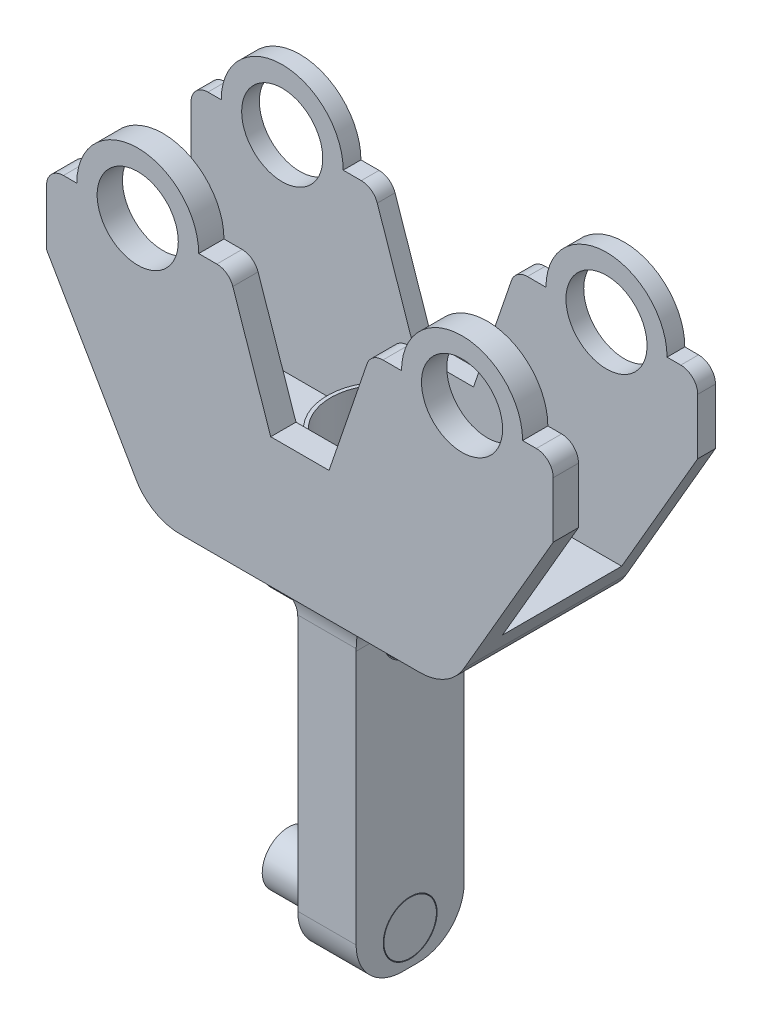
from build123d import *

# Parameters (mm, degrees)
BOSS_EXTRU_1_DEPTH           = 1.2
BOSS_EXTRU_1_DEPTH_BACK      = 1.2
BOSS_EXTRU_3_DEPTH           = 0.8
BOSS_EXTRU_3_DEPTH_BACK      = 0.8
CONG_1_R                     = 0.6
ENL_V_MAT_EXTRU_1_DEPTH      = 0.8
ENL_V_MAT_EXTRU_1_DEPTH_BACK = 1.2
ESQUISSE3_R                  = 0.39855318391120886
ESQUISSE3_R_2                = 0.3998963443973292
ESQUISSE4_R                  = 0.388799523274085
BOSS_EXTRU_4_DEPTH           = 1.8
ESQUISSE4_R_2                = 0.3866675679352152
BOSS_EXTRU_4_2_DEPTH         = 1.8
ENL_V_MAT_EXTRU_2_DEPTH      = 2.8
ENL_V_MAT_EXTRU_2_DEPTH_BACK = 1.2
ESQUISSE5_W                  = 8.040608678581814
ESQUISSE5_H                  = 1.7635077316521461
ESQUISSE6_R                  = 0.5999999999999998
ENL_V_MAT_EXTRU_3_DEPTH      = 2.8
ESQUISSE7_R                  = 0.850642706215731
ESQUISSE7_R_2                = 0.7992203183173335
BOSS_EXTRU_5_DEPTH           = 0.89
ESQUISSE8_R                  = 0.5002156559531135
ENL_V_MAT_EXTRU_4_DEPTH      = 0.8
CONG_2_R                     = 0.75
CONG_3_R                     = 0.25
CONG_4_R                     = 0.685


with BuildPart() as part:
    # Esquisse1 → Boss.-Extru.1 (new, two sides: drawn at the far end of the back side and taken through both)
    with BuildSketch(Plane.XY.offset(-BOSS_EXTRU_1_DEPTH_BACK)):
        with BuildLine():
            Line((-0.669489396089797, 0.2561851906117251), (-2.2103508294642955, 2.912288317285255))
            Line((-2.2103508294642955, 2.912288317285255), (-2.2103508294642955, 3.987809597780656))
            Line((-2.2103508294642955, 3.987809597780656), (-1.7634137063925426, 3.987809597780656))
            ThreePointArc((-1.7634137063925426, 3.987809597780656), (-0.861394361103266, 4.889828943069933), (0.04062498418601097, 3.987809597780656))
            Line((0.04062498418601097, 3.987809597780656), (0.48756210725776383, 3.987809597780656))
            Line((0.48756210725776383, 3.987809597780656), (1.1061040002270477, 2.173647118407281))
            Line((1.1061040002270477, 2.173647118407281), (1.9690865158121553, 2.173647118407281))
            Line((1.9690865158121553, 2.173647118407281), (2.587628408781439, 3.987809597780656))
            Line((2.587628408781439, 3.987809597780656), (3.04100557345784, 3.987809597780656))
            ThreePointArc((3.04100557345784, 3.987809597780656), (3.9365848771424687, 4.883388901465285), (4.832164180827098, 3.987809597780656))
            Line((4.832164180827098, 3.987809597780656), (5.285541345503499, 3.987809597780656))
            Line((5.285541345503499, 3.987809597780656), (5.285541345503499, 2.912288317285255))
            Line((5.285541345503499, 2.912288317285255), (3.744679912129, 0.2561851906117251))
            Line((3.744679912129, 0.2561851906117251), (-0.669489396089797, 0.2561851906117251))
        make_face()
    extrude(amount=BOSS_EXTRU_1_DEPTH + BOSS_EXTRU_1_DEPTH_BACK)

    # Esquisse1<4> → Boss.-Extru.3 (add, two sides: drawn at the far end of the back side and taken through both)
    with BuildSketch(Plane.XY.offset(-BOSS_EXTRU_3_DEPTH_BACK)):
        Polygon((1.9690865158121553, 0.2561851906117251), (1.1061040002270477, 0.2561851906117251), (1.1061040002270477, 0), (1.1061040002270477, -4.485240552308376), (1.1061040002270477, -4.791310446559649), (1.9690865158121553, -4.791310446559649), (1.969086515812155, -3.887850080955423), (1.9690865158121553, -0.6623689479604176), (1.9690865158121544, 0.05202764865298772), align=None)
    extrude(amount=BOSS_EXTRU_3_DEPTH + BOSS_EXTRU_3_DEPTH_BACK)

    # Congé1
    # the kernel refuses this fillet: 0.6 mm, written as the material it adds along each edge
    with BuildSketch(Plane(origin=(1.1061040002270477, 0.2561851906117251, -0.8), x_dir=(-1, 0, 0), z_dir=(0, 0, 1))) as cong_1_piece_1:
        with BuildLine():
            CenterArc((CONG_1_R, CONG_1_R), CONG_1_R, 180, 90)
            Line((-2.2e-16, CONG_1_R), (-CONG_1_R * 0.02, CONG_1_R))
            Line((-CONG_1_R * 0.02, CONG_1_R), (-CONG_1_R * 0.02, -CONG_1_R * 0.02))
            Line((-CONG_1_R * 0.02, -CONG_1_R * 0.02), (CONG_1_R, -CONG_1_R * 0.02))
            Line((CONG_1_R, -CONG_1_R * 0.02), (CONG_1_R, 0))
        make_face()
    extrude(amount=1.6)
    with BuildSketch(Plane(origin=(1.9690865158121553, 0.2561851906117251, 0.8), x_dir=(0, 1.4e-16, 1), z_dir=(-1, 0, 0))) as cong_1_piece_2:
        with BuildLine():
            CenterArc((0.5999999999999998, -0.5656854249492381), CONG_1_R, 109.47122063449068, 70.52877936550932)
            Line((-1.9e-16, -0.565685424949238), (-0.0120000000000002, -0.565685424949238))
            Line((-0.0120000000000002, -0.565685424949238), (-0.01200000000000001, 0))
            Line((-0.01200000000000001, 0), (0, 0.01200000000000001))
            ThreePointArc((0, 0.01200000000000001), (0.19999999999999996, 0.01199999999999998), (0.3959999999999999, 0.01131370849898478))
            Line((0.3959999999999999, 0.01131370849898478), (0.3999999999999999, 0))
        make_face()
    extrude(amount=0.8629825155851076)
    with BuildSketch(Plane(origin=(1.9690865158121553, 0.2561851906117251, 0.8), x_dir=(1, 0, 0), z_dir=(0, 0, -1))) as cong_1_piece_3:
        with BuildLine():
            CenterArc((CONG_1_R, CONG_1_R), CONG_1_R, 180, 90)
            Line((-2.2e-16, CONG_1_R), (-CONG_1_R * 0.02, CONG_1_R))
            Line((-CONG_1_R * 0.02, CONG_1_R), (-CONG_1_R * 0.02, -CONG_1_R * 0.02))
            Line((-CONG_1_R * 0.02, -CONG_1_R * 0.02), (CONG_1_R, -CONG_1_R * 0.02))
            Line((CONG_1_R, -CONG_1_R * 0.02), (CONG_1_R, 0))
        make_face()
    extrude(amount=1.6)
    with BuildSketch(Plane(origin=(1.9690865158121553, 0.2561851906117251, -0.8), x_dir=(0, 1.4e-16, -1), z_dir=(-1, 0, 0))) as cong_1_piece_4:
        with BuildLine():
            CenterArc((0.5999999999999998, 0.5656854249492381), CONG_1_R, 180, 70.52877936550931)
            Line((-1.9e-16, 0.565685424949238), (-0.0120000000000002, 0.565685424949238))
            Line((-0.0120000000000002, 0.565685424949238), (-0.01200000000000001, 0))
            Line((-0.01200000000000001, 0), (0, -0.01200000000000001))
            ThreePointArc((0, -0.01200000000000001), (0.19999999999999996, -0.01199999999999998), (0.3959999999999999, -0.01131370849898478))
            Line((0.3959999999999999, -0.01131370849898478), (0.3999999999999999, 0))
        make_face()
    extrude(amount=0.8629825155851076)
    with BuildSketch(Plane(origin=(1.1061040002270475, 0.2561851906117251, -2.3), x_dir=(-1, 0, 0), z_dir=(0, 0, 1))) as cong_1_piece_5a_section:
        with BuildLine():
            CenterArc((CONG_1_R, CONG_1_R), CONG_1_R, 180, 90)
            Line((-4.4e-16, CONG_1_R), (-CONG_1_R * 0.02, CONG_1_R))
            Line((-CONG_1_R * 0.02, CONG_1_R), (-CONG_1_R * 0.02, -CONG_1_R * 0.02))
            Line((-CONG_1_R * 0.02, -CONG_1_R * 0.02), (CONG_1_R, -CONG_1_R * 0.02))
            Line((CONG_1_R, -CONG_1_R * 0.02), (CONG_1_R, 0))
        make_face()
    cong_1_piece_5a = extrude(amount=3.0999999999999996, mode=Mode.PRIVATE)
    cong_1_piece_5a = split(cong_1_piece_5a, bisect_by=Plane(origin=(0.9702669316669525, 0.12034812205163004, -1.2), z_dir=(0, 0, 1)), keep=Keep.TOP, mode=Mode.PRIVATE)
    cong_1_piece_5a = split(cong_1_piece_5a, bisect_by=Plane(origin=(0.9702669316669525, 0.12034812205163004, -0.8), z_dir=(0, 0, -1)), keep=Keep.TOP, mode=Mode.PRIVATE)
    with BuildSketch(Plane(origin=(1.9690865158121553, 0.2561851906117251, -0.8), x_dir=(0, 1.4e-16, -1), z_dir=(-1, 0, 0))) as cong_1_piece_5b_section:
        with BuildLine():
            CenterArc((0.5999999999999998, 0.5656854249492381), CONG_1_R, 180, 70.52877936550931)
            Line((-1.9e-16, 0.565685424949238), (-0.0120000000000002, 0.565685424949238))
            Line((-0.0120000000000002, 0.565685424949238), (-0.01200000000000001, 0))
            Line((-0.01200000000000001, 0), (0, -0.01200000000000001))
            ThreePointArc((0, -0.01200000000000001), (0.19999999999999996, -0.01199999999999998), (0.3959999999999999, -0.01131370849898478))
            Line((0.3959999999999999, -0.01131370849898478), (0.3999999999999999, 0))
        make_face()
    cong_1_piece_5b = extrude(amount=2.2771960779582026, mode=Mode.PRIVATE)
    cong_1_piece_5b = split(cong_1_piece_5b, bisect_by=Plane(origin=(1.1061040002270477, 0.12052150444088067, -0.9027063580397728), z_dir=(-1, 0, 0)), keep=Keep.TOP, mode=Mode.PRIVATE)
    cong_1_piece_5 = cong_1_piece_5a & cong_1_piece_5b
    add(cong_1_piece_5)
    with BuildSketch(Plane(origin=(1.9690865158121553, 0.2561851906117251, 0.8), x_dir=(0, 1.4e-16, 1), z_dir=(-1, 0, 0))) as cong_1_piece_6a_section:
        with BuildLine():
            CenterArc((0.5999999999999998, -0.5656854249492381), CONG_1_R, 109.47122063449068, 70.52877936550932)
            Line((-1.9e-16, -0.565685424949238), (-0.0120000000000002, -0.565685424949238))
            Line((-0.0120000000000002, -0.565685424949238), (-0.01200000000000001, 0))
            Line((-0.01200000000000001, 0), (0, 0.01200000000000001))
            ThreePointArc((0, 0.01200000000000001), (0.19999999999999996, 0.01199999999999998), (0.3959999999999999, 0.01131370849898478))
            Line((0.3959999999999999, 0.01131370849898478), (0.3999999999999999, 0))
        make_face()
    cong_1_piece_6a = extrude(amount=2.2771960779582026, mode=Mode.PRIVATE)
    cong_1_piece_6a = split(cong_1_piece_6a, bisect_by=Plane(origin=(1.1061040002270477, 0.12052150444088058, 0.9027063580397728), z_dir=(-1, 0, 0)), keep=Keep.TOP, mode=Mode.PRIVATE)
    with BuildSketch(Plane(origin=(1.1061040002270477, 0.2561851906117251, -0.8), x_dir=(-1, 0, 0), z_dir=(0, 0, 1))) as cong_1_piece_6b_section:
        with BuildLine():
            CenterArc((CONG_1_R, CONG_1_R), CONG_1_R, 180, 90)
            Line((-2.2e-16, CONG_1_R), (-CONG_1_R * 0.02, CONG_1_R))
            Line((-CONG_1_R * 0.02, CONG_1_R), (-CONG_1_R * 0.02, -CONG_1_R * 0.02))
            Line((-CONG_1_R * 0.02, -CONG_1_R * 0.02), (CONG_1_R, -CONG_1_R * 0.02))
            Line((CONG_1_R, -CONG_1_R * 0.02), (CONG_1_R, 0))
        make_face()
    cong_1_piece_6b = extrude(amount=3.0999999999999996, mode=Mode.PRIVATE)
    cong_1_piece_6b = split(cong_1_piece_6b, bisect_by=Plane(origin=(0.9702669316669524, 0.12034812205163004, 1.2), z_dir=(0, 0, -1)), keep=Keep.TOP, mode=Mode.PRIVATE)
    cong_1_piece_6b = split(cong_1_piece_6b, bisect_by=Plane(origin=(0.9702669316669524, 0.12034812205163004, 0.8), z_dir=(0, 0, 1)), keep=Keep.TOP, mode=Mode.PRIVATE)
    cong_1_piece_6 = cong_1_piece_6a & cong_1_piece_6b
    add(cong_1_piece_6)
    with BuildSketch(Plane(origin=(3.3833000781852505, 0.2561851906117251, 0.8), x_dir=(0, 1.4e-16, 1), z_dir=(-1, 0, 0))) as cong_1_piece_7a_section:
        with BuildLine():
            CenterArc((0.5999999999999998, -0.5656854249492381), CONG_1_R, 109.47122063449068, 70.52877936550932)
            Line((-1.9e-16, -0.565685424949238), (-0.0120000000000002, -0.565685424949238))
            Line((-0.0120000000000002, -0.565685424949238), (-0.01200000000000001, 0))
            Line((-0.01200000000000001, 0), (0, 0.01200000000000001))
            ThreePointArc((0, 0.01200000000000001), (0.19999999999999996, 0.01199999999999998), (0.3959999999999999, 0.01131370849898478))
            Line((0.3959999999999999, 0.01131370849898478), (0.3999999999999999, 0))
        make_face()
    cong_1_piece_7a = extrude(amount=2.2771960779582026, mode=Mode.PRIVATE)
    cong_1_piece_7a = split(cong_1_piece_7a, bisect_by=Plane(origin=(1.9690865158121542, 0.12052150444088383, 0.9027063580397718), z_dir=(1, 2.5e-16, 0)), keep=Keep.TOP, mode=Mode.PRIVATE)
    with BuildSketch(Plane(origin=(1.969086515812154, 0.2561851906117251, 2.3), x_dir=(1, 0, 0), z_dir=(0, 0, -1))) as cong_1_piece_7b_section:
        with BuildLine():
            CenterArc((CONG_1_R, CONG_1_R), CONG_1_R, 180, 90)
            Line((2.2e-16, CONG_1_R), (-CONG_1_R * 0.02, CONG_1_R))
            Line((-CONG_1_R * 0.02, CONG_1_R), (-CONG_1_R * 0.02, -CONG_1_R * 0.02))
            Line((-CONG_1_R * 0.02, -CONG_1_R * 0.02), (CONG_1_R, -CONG_1_R * 0.02))
            Line((CONG_1_R, -CONG_1_R * 0.02), (CONG_1_R, 0))
        make_face()
    cong_1_piece_7b = extrude(amount=3.0999999999999996, mode=Mode.PRIVATE)
    cong_1_piece_7b = split(cong_1_piece_7b, bisect_by=Plane(origin=(2.104923584372249, 0.12034812205162959, 1.2), z_dir=(0, 0, -1)), keep=Keep.TOP, mode=Mode.PRIVATE)
    cong_1_piece_7b = split(cong_1_piece_7b, bisect_by=Plane(origin=(2.104923584372249, 0.12034812205162959, 0.8), z_dir=(0, 0, 1)), keep=Keep.TOP, mode=Mode.PRIVATE)
    cong_1_piece_7 = cong_1_piece_7a & cong_1_piece_7b
    add(cong_1_piece_7)
    with BuildSketch(Plane(origin=(3.3833000781852505, 0.2561851906117251, -0.8), x_dir=(0, 1.4e-16, -1), z_dir=(-1, 0, 0))) as cong_1_piece_8a_section:
        with BuildLine():
            CenterArc((0.5999999999999998, 0.5656854249492381), CONG_1_R, 180, 70.52877936550931)
            Line((-1.9e-16, 0.565685424949238), (-0.0120000000000002, 0.565685424949238))
            Line((-0.0120000000000002, 0.565685424949238), (-0.01200000000000001, 0))
            Line((-0.01200000000000001, 0), (0, -0.01200000000000001))
            ThreePointArc((0, -0.01200000000000001), (0.19999999999999996, -0.01199999999999998), (0.3959999999999999, -0.01131370849898478))
            Line((0.3959999999999999, -0.01131370849898478), (0.3999999999999999, 0))
        make_face()
    cong_1_piece_8a = extrude(amount=2.2771960779582026, mode=Mode.PRIVATE)
    cong_1_piece_8a = split(cong_1_piece_8a, bisect_by=Plane(origin=(1.9690865158121542, 0.12052150444088383, -0.9027063580397665), z_dir=(1, 2.5e-16, 0)), keep=Keep.TOP, mode=Mode.PRIVATE)
    with BuildSketch(Plane(origin=(1.9690865158121553, 0.2561851906117251, 0.8), x_dir=(1, 0, 0), z_dir=(0, 0, -1))) as cong_1_piece_8b_section:
        with BuildLine():
            CenterArc((CONG_1_R, CONG_1_R), CONG_1_R, 180, 90)
            Line((-2.2e-16, CONG_1_R), (-CONG_1_R * 0.02, CONG_1_R))
            Line((-CONG_1_R * 0.02, CONG_1_R), (-CONG_1_R * 0.02, -CONG_1_R * 0.02))
            Line((-CONG_1_R * 0.02, -CONG_1_R * 0.02), (CONG_1_R, -CONG_1_R * 0.02))
            Line((CONG_1_R, -CONG_1_R * 0.02), (CONG_1_R, 0))
        make_face()
    cong_1_piece_8b = extrude(amount=3.0999999999999996, mode=Mode.PRIVATE)
    cong_1_piece_8b = split(cong_1_piece_8b, bisect_by=Plane(origin=(2.104923584372249, 0.12034812205162959, -1.2), z_dir=(0, 0, 1)), keep=Keep.TOP, mode=Mode.PRIVATE)
    cong_1_piece_8b = split(cong_1_piece_8b, bisect_by=Plane(origin=(2.104923584372249, 0.12034812205162959, -0.8), z_dir=(0, 0, -1)), keep=Keep.TOP, mode=Mode.PRIVATE)
    cong_1_piece_8 = cong_1_piece_8a & cong_1_piece_8b
    add(cong_1_piece_8)

    # Esquisse3 → Enlèv. mat.-Extru.1 (cut, two sides: drawn at the far end of the back side and taken through both)
    with BuildSketch(Plane.ZY.offset(-1.1061040002270477).offset(-ENL_V_MAT_EXTRU_1_DEPTH_BACK)):
        with Locations(Location((0, -4.284911622256936, 0), (0, 0, 180))):
            Circle(ESQUISSE3_R)
        with Locations(Location((0, -0.4084359374143761, 0), (0, 0, 170.700529822))):
            Circle(ESQUISSE3_R_2)
    extrude(amount=ENL_V_MAT_EXTRU_1_DEPTH + ENL_V_MAT_EXTRU_1_DEPTH_BACK, mode=Mode.SUBTRACT)

    # Esquisse5 → Enlèv. mat.-Extru.2 (cut, two sides: drawn at the far end of the back side and taken through both)
    with BuildSketch(Plane(origin=(0, 2.173647118407281, 0), x_dir=(1, 0, 0), z_dir=(0, 1, 0)).offset(-ENL_V_MAT_EXTRU_2_DEPTH_BACK)):
        with Locations((1.525263036119935, 0.05549499854850881)):
            Rectangle(ESQUISSE5_W, ESQUISSE5_H)
    extrude(amount=ENL_V_MAT_EXTRU_2_DEPTH + ENL_V_MAT_EXTRU_2_DEPTH_BACK, mode=Mode.SUBTRACT)

    # Esquisse6 → Enlèv. mat.-Extru.3 (cut)
    with BuildSketch(Plane(origin=(0, 0, -1.2), x_dir=(-1, 0, 0), z_dir=(0, 0, -1))):
        with Locations(Location((-3.9365848771424687, 3.987809597780656, 0), (0, 0, 180))):
            Circle(ESQUISSE6_R)
        with Locations(Location((0.861394361103266, 3.987809597780656, 0), (0, 0, 180))):
            Circle(ESQUISSE6_R)
    extrude(amount=-ENL_V_MAT_EXTRU_3_DEPTH, mode=Mode.SUBTRACT)

    # Esquisse7 → Boss.-Extru.5 (add)
    with BuildSketch(Plane(origin=(0, 0.9736471184072814, 0), x_dir=(1, 0, 0), z_dir=(0, 1, 0))):
        with Locations(Location((1.537595258019601, 0.05549499854850886, 0), (0, 0, 270))):
            Circle(ESQUISSE7_R)
        with Locations(Location((1.537595258019601, 0.05549499854850886, 0), (0, 0, 270))):
            Circle(ESQUISSE7_R_2, mode=Mode.SUBTRACT)
    extrude(amount=BOSS_EXTRU_5_DEPTH)

    # Esquisse8 → Enlèv. mat.-Extru.4 (cut)
    with BuildSketch(Plane(origin=(0, 0.9736471184072814, 0), x_dir=(1, 0, 0), z_dir=(0, 1, 0))):
        with Locations(Location((1.537595258019601, 0.05549499854850886, 0), (0, 0, 270))):
            Circle(ESQUISSE8_R)
    extrude(amount=-ENL_V_MAT_EXTRU_4_DEPTH, mode=Mode.SUBTRACT)

    # Congé2
    cong_2_edges = [part.edges().sort_by_distance(p)[0] for p in [
        (3.744679912129, 0.2561851906117251, 0),
        (-0.669489396089797, 0.2561851906117251, 0),
    ]]
    fillet(cong_2_edges, radius=CONG_2_R)

    # Congé3
    cong_3_edges = [part.edges().sort_by_distance(p)[0] for p in [
        (2.587628408781439, 3.987809597780656, 1.0131294336387822),
        (0.48756210725776383, 3.987809597780656, 1.013129433638782),
        (-2.2103508294642955, 3.987809597780656, 1.013129433638782),
        (5.285541345503499, 3.987809597780656, 1.013129433638782),
        (5.285541345503499, 3.987809597780656, -1.0686244321872909),
        (-2.2103508294642955, 3.987809597780656, -1.0686244321872909),
        (0.48756210725776383, 3.987809597780656, -1.0686244321872909),
        (2.587628408781439, 3.987809597780656, -1.0686244321872909),
    ]]
    fillet(cong_3_edges, radius=CONG_3_R)

    # Congé4
    cong_4_edges = [part.edges().sort_by_distance(p)[0] for p in [
        (1.5375952580196015, -4.791310446559649, 0.8),
        (1.5375952580196015, -4.791310446559649, -0.8),
    ]]
    fillet(cong_4_edges, radius=CONG_4_R)


with BuildPart() as body_2:
    # Esquisse4 → Boss.-Extru.4 (new body)
    with BuildSketch(Plane(origin=(1.9690865158121544, 3.5e-16, 0), x_dir=(0, 0, -1), z_dir=(1, 1.8e-16, 0))):
        with Locations(Location((0, -4.284911622256936, 0), (0, 0, 90))):
            Circle(ESQUISSE4_R)
    extrude(amount=-BOSS_EXTRU_4_DEPTH)


with BuildPart() as body_3:
    # Esquisse4 → Boss.-Extru.4 2 (new body)
    with BuildSketch(Plane(origin=(1.9690865158121544, 3.5e-16, 0), x_dir=(0, 0, -1), z_dir=(1, 1.8e-16, 0))):
        with Locations(Location((0, -0.4084359374143765, 0), (0, 0, 90))):
            Circle(ESQUISSE4_R_2)
    extrude(amount=-BOSS_EXTRU_4_2_DEPTH)


solid = Compound([part.part, body_2.part, body_3.part])
